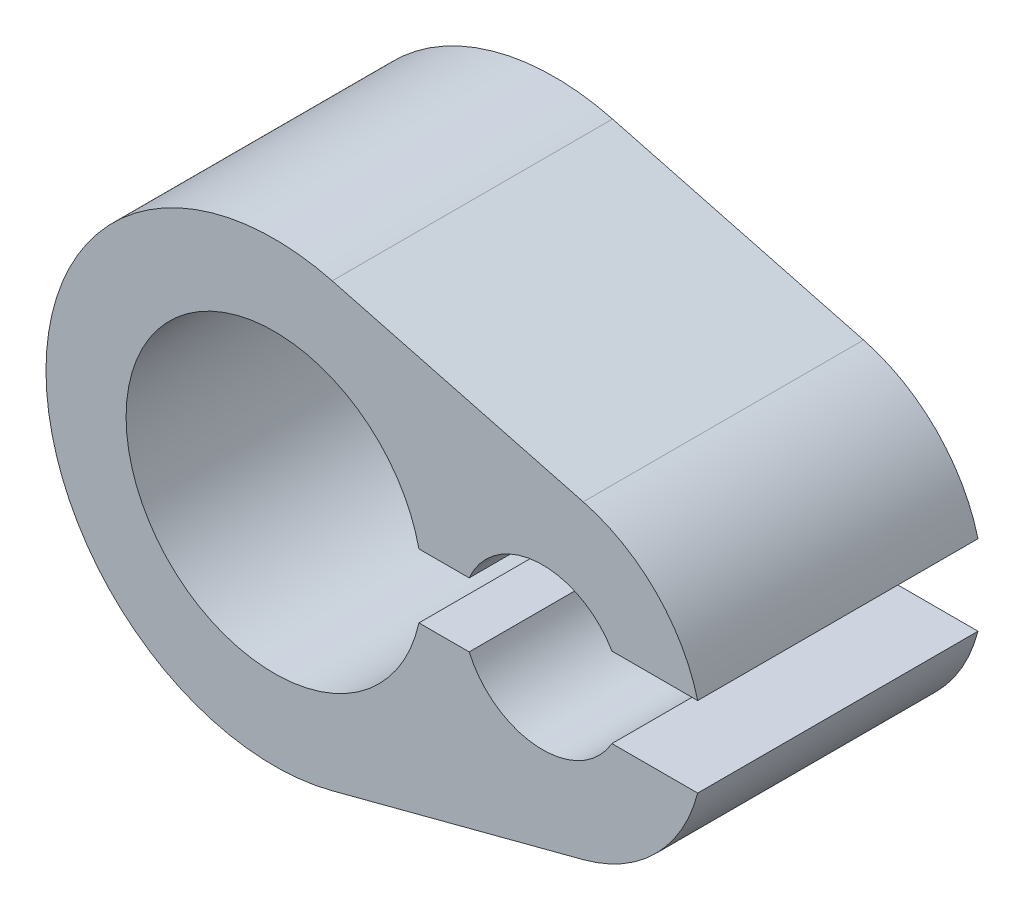
from build123d import *

# Parameters (mm, degrees)
BOSS_EXTRUDE1_DEPTH = 7


with BuildPart() as part:
    # Sketch1 → Boss-Extrude1 (new body)
    with BuildSketch(Plane.XY):
        with BuildLine():
            Line((1.446268657, 5.513465967), (7.714925373, 3.869098924))
            ThreePointArc((7.714925373, 3.869098924), (9.533874569, 2.822969169), (10.572983346, 1))
            Line((10.572983346, 1), (8.432050808, 1))
            ThreePointArc((8.432050808, 1), (6.587976728, 1.996860232), (4.866969722, 0.8))
            Line((4.866969722, 0.8), (3.612478374, 0.8))
            ThreePointArc((3.612478374, 0.8), (-3.7, 0), (3.612478374, -0.8))
            Line((3.612478374, -0.8), (4.866969722, -0.8))
            ThreePointArc((4.866969722, -0.8), (6.587976728, -1.996860232), (8.432050808, -1))
            Line((8.432050808, -1), (10.572983346, -1))
            ThreePointArc((10.572983346, -1), (9.533874569, -2.822969169), (7.714925373, -3.869098924))
            Line((7.714925373, -3.869098924), (1.446268657, -5.513465967))
            ThreePointArc((1.446268657, -5.513465967), (-5.7, 0), (1.446268657, 5.513465967))
        make_face()
    extrude(amount=BOSS_EXTRUDE1_DEPTH)


solid = part.part
